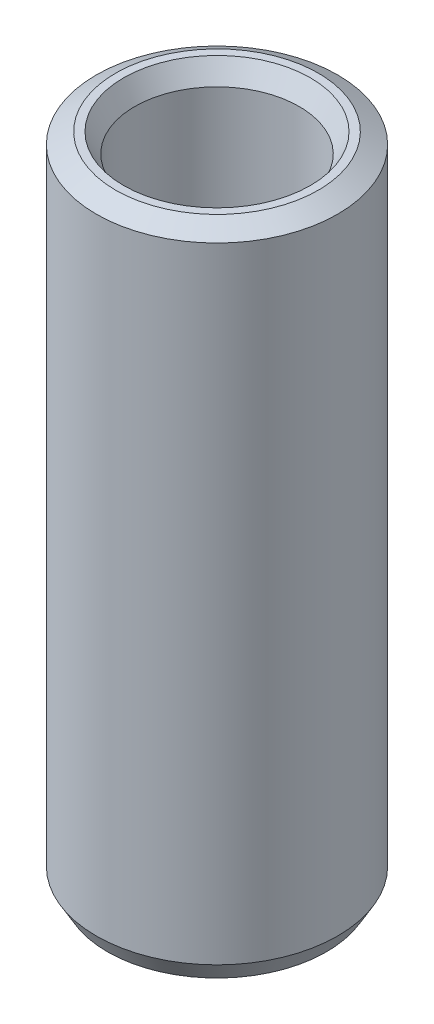
from build123d import *
from OCP.BRepFilletAPI import BRepFilletAPI_MakeChamfer

# Parameters (mm, degrees)
SKETCH1_R           = 35
BOSS_EXTRUDE1_DEPTH = 190.138838777
SKETCH2_R           = 23.850901266
CUT_EXTRUDE1_DEPTH  = 197.47589677
CHAMFER1_SIZE       = 3.230452999
CHAMFER1_SIZE2      = 5.595308726


with BuildPart() as part:
    # Sketch1 → Boss-Extrude1 (new body)
    with BuildSketch(Plane(origin=(0, 0, 0), x_dir=(1, 0, 0), z_dir=(0, 1, 0))):
        Circle(SKETCH1_R)
    extrude(amount=BOSS_EXTRUDE1_DEPTH)

    # Sketch2 → Cut-Extrude1 (cut, through all)
    with BuildSketch(Plane(origin=(0, 0, 0), x_dir=(1, 0, 0), z_dir=(0, 1, 0))):
        Circle(SKETCH2_R)
    extrude(amount=CUT_EXTRUDE1_DEPTH, mode=Mode.SUBTRACT)

    # Chamfer1: one chamfer whose edges measure the first distance from different faces: ONE call of the kernel's chamfer builder (chamfer() names one face for all edges)
    chamfer1_edges_1 = [part.edges().sort_by_distance(p)[0] for p in [
        (-23.850901266, 190.138838777, 0),
    ]]
    chamfer1_side_1 = [part.faces().sort_by_distance(p)[0] for p in [
        (-34.010050506, 190.138838777, 0),
    ]]
    chamfer1_edges_2 = [part.edges().sort_by_distance(p)[0] for p in [
        (-23.850901266, 0, 0),
    ]]
    chamfer1_side_2 = [part.faces().sort_by_distance(p)[0] for p in [
        (-23.850901266, 95.069419388, 0),
    ]]
    chamfer1_edges_3 = [part.edges().sort_by_distance(p)[0] for p in [
        (-35, 0, 0),
    ]]
    chamfer1_side_3 = [part.faces().sort_by_distance(p)[0] for p in [
        (-34.010050506, 0, 0),
    ]]
    chamfer1_edges_4 = [part.edges().sort_by_distance(p)[0] for p in [
        (-35, 190.138838777, 0),
    ]]
    chamfer1_side_4 = [part.faces().sort_by_distance(p)[0] for p in [
        (-35, 95.069419388, 0),
    ]]
    chamfer1 = BRepFilletAPI_MakeChamfer(part.part.solid().wrapped)
    for e in chamfer1_edges_1:
        chamfer1.Add(CHAMFER1_SIZE, CHAMFER1_SIZE2, e.wrapped, chamfer1_side_1[0].wrapped)  # the first distance lies on this face
    for e in chamfer1_edges_2:
        chamfer1.Add(CHAMFER1_SIZE, CHAMFER1_SIZE2, e.wrapped, chamfer1_side_2[0].wrapped)  # the first distance lies on this face
    for e in chamfer1_edges_3:
        chamfer1.Add(CHAMFER1_SIZE, CHAMFER1_SIZE2, e.wrapped, chamfer1_side_3[0].wrapped)  # the first distance lies on this face
    for e in chamfer1_edges_4:
        chamfer1.Add(CHAMFER1_SIZE, CHAMFER1_SIZE2, e.wrapped, chamfer1_side_4[0].wrapped)  # the first distance lies on this face
    add(Compound.cast(chamfer1.Shape()), mode=Mode.REPLACE)


solid = part.part
